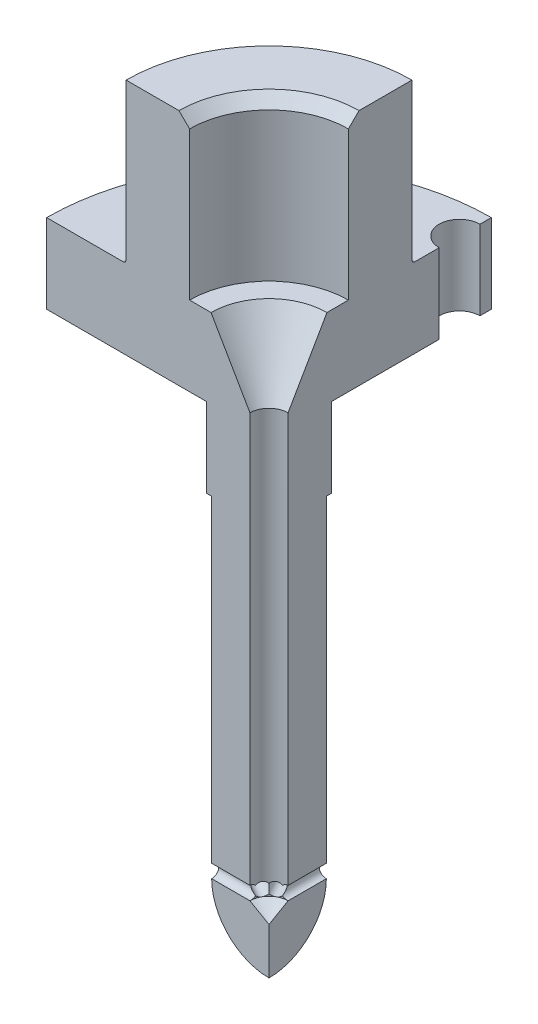
from build123d import *

# Parameters (mm, degrees)
SKETCH1_W               = 3.0607
SKETCH1_H               = 26.48712
SKETCH3_R               = 4.5847
SKETCH3_R_2             = 1.524
BOSS_EXTRUDE1_DEPTH     = 6.35
BOSS_EXTRUDE2_START     = 6.35
SKETCH4_R               = 17.78
SKETCH4_R_2             = 1.524
BOSS_EXTRUDE2_DEPTH     = 6.35
CUT_EXTRUDE2_REACH      = 48.561
SKETCH11_R              = 1.63195
CIRPATTERN2_COUNT       = 6
CHAMFER1_SIZE           = 3.11277
CHAMFER1_SIZE2          = 5.391475792
SKETCH13_R              = 11.43
SKETCH13_R_2            = 6.35
BOSS_EXTRUDE4_DEPTH     = 12.7
FILLET4_R               = 0.254
CHAMFER2_SIZE           = 0.851662
CHAMFER2_SIZE2          = 0.83947
SKETCH15_R              = 4.99999
SKETCH15_R_2            = 3.556
BOSS_EXTRUDE5_DEPTH     = 6.35
CUT_EXTRUDE3_REACH      = 58.272
SKETCH20_R              = 0.5334
CIRPATTERN3_COUNT       = 12
CUT_EXTRUDE4_DEPTH      = 62.816852509
CUT_EXTRUDE4_DEPTH_BACK = 62.816852509


with BuildPart() as part:
    # Sketch1 → Revolve2 (revolve)
    with BuildSketch(Plane.XY, mode=Mode.PRIVATE) as revolve2_sk:
        with Locations((-3.05435, 9.835214136)):
            Rectangle(SKETCH1_W, SKETCH1_H)
    revolve(revolve2_sk.sketch.rotate(Axis((0, 8.215698649, 0), (0, -1, 0)), 270), axis=Axis((0, 8.215698649, 0), (0, -1, 0)))

    # Sketch3 → Boss-Extrude1 (add)
    with BuildSketch(Plane(origin=(0, 23.078774136, 0), x_dir=(-1, 0, 0), z_dir=(0, -1, 0))):
        with Locations(Location((0, 0, 0), (0, 0, 270))):
            Circle(SKETCH3_R)
        with Locations(Location((0, 0, 0), (0, 0, 270))):
            Circle(SKETCH3_R_2, mode=Mode.SUBTRACT)
    extrude(amount=-BOSS_EXTRUDE1_DEPTH)

    # Sketch4 → Boss-Extrude2 (add)
    with BuildSketch(Plane(origin=(0, 29.428774136, 0), x_dir=(1, 0, 0), z_dir=(0, 1, 0)).offset(BOSS_EXTRUDE2_START)):
        with Locations(Location((0, 0, 0), (0, 0, 270))):
            Circle(SKETCH4_R)
        with Locations(Location((0, 0, 0), (0, 0, 270))):
            Circle(SKETCH4_R_2, mode=Mode.SUBTRACT)
    extrude(amount=-BOSS_EXTRUDE2_DEPTH)

    # Sketch11 → Cut-Extrude2 (cut, up to next)
    with BuildSketch(Plane(origin=(0, 35.778774136, 0), x_dir=(1, 0, 0), z_dir=(0, 1, 0)), mode=Mode.PRIVATE) as cut_extrude2_sk1:
        with Locations(Location((0, -15.24, 0), (0, 0, 270))):
            Circle(SKETCH11_R)
    cut_extrude2_tool1 = extrude(cut_extrude2_sk1.sketch, amount=-CUT_EXTRUDE2_REACH, mode=Mode.PRIVATE) & part.part
    cut_extrude2 = cut_extrude2_tool1.solids().sort_by_distance((0, 35.778774, 15.24))[0]
    add(cut_extrude2, mode=Mode.SUBTRACT)

    # CirPattern2: Cut-Extrude2 ×6 about axis
    cirpattern2_axis = Axis((0, 0, 0), (0, 1, 0))
    for i in range(1, CIRPATTERN2_COUNT):
        add(cut_extrude2.rotate(cirpattern2_axis, i * 360 / CIRPATTERN2_COUNT), mode=Mode.SUBTRACT)

    # Chamfer1
    chamfer1_edges = [part.edges().sort_by_distance(p)[0] for p in [
        (0, 35.778774136, -1.524),
    ]]
    chamfer1_side = [part.faces().sort_by_distance(p)[0] for p in [
        (0, 35.778774136, -17.277105657),
    ]]
    chamfer(chamfer1_edges, length=CHAMFER1_SIZE, length2=CHAMFER1_SIZE2, reference=chamfer1_side[0])

    # Sketch13 → Boss-Extrude4 (add)
    with BuildSketch(Plane(origin=(0, 35.778774136, 0), x_dir=(1, 0, 0), z_dir=(0, 1, 0))):
        with Locations(Location((0, 0, 0), (0, 0, 270))):
            Circle(SKETCH13_R)
        with Locations(Location((0, 0, 0), (0, 0, 270))):
            Circle(SKETCH13_R_2, mode=Mode.SUBTRACT)
    extrude(amount=BOSS_EXTRUDE4_DEPTH)

    # Fillet4
    fillet4_edges = [part.edges().sort_by_distance(p)[0] for p in [
        (0, 35.778774136, -11.43),
    ]]
    fillet(fillet4_edges, radius=FILLET4_R)

    # Chamfer2
    chamfer2_edges = [part.edges().sort_by_distance(p)[0] for p in [
        (0, 48.478774136, -6.35),
    ]]
    chamfer2_side = [part.faces().sort_by_distance(p)[0] for p in [
        (0, 48.478774136, -11.10671078),
    ]]
    chamfer(chamfer2_edges, length=CHAMFER2_SIZE, length2=CHAMFER2_SIZE2, reference=chamfer2_side[0])

    # Sketch15 → Boss-Extrude5 (add)
    with BuildSketch(Plane.XZ.offset(-29.428774136)):
        with Locations(Location((0, 0, 0), (0, 0, 90))):
            Circle(SKETCH15_R)
        Circle(SKETCH15_R_2, mode=Mode.SUBTRACT)
    extrude(amount=BOSS_EXTRUDE5_DEPTH)

    # Sketch19 → Revolve4 (revolve)
    with BuildSketch(Plane.XY):
        with BuildLine():
            Line((0, -3.408345864), (-4.5847, -3.408345864))
            ThreePointArc((-4.5847, -3.408345864), (-3.24187246, -6.650218324), (0, -7.993045864))
            Line((0, -7.993045864), (0, -3.408345864))
        make_face()
    revolve(axis=Axis((0, -3.408345864, 0), (0, -1, 0)))

    # Sketch20 → Cut-Extrude3 (cut, up to next)
    with BuildSketch(Plane.ZY.offset(4.5847), mode=Mode.PRIVATE) as cut_extrude3_sk1:
        with Locations(Location((0, -2.874945864, 0), (0, 0, 270.000000003))):
            Circle(SKETCH20_R)
    cut_extrude3_tool1 = extrude(cut_extrude3_sk1.sketch, amount=-CUT_EXTRUDE3_REACH, mode=Mode.PRIVATE) & part.part
    cut_extrude3 = cut_extrude3_tool1.solids().sort_by_distance((-4.5847, -2.874946, 0))[0]
    add(cut_extrude3, mode=Mode.SUBTRACT)

    # CirPattern3: Cut-Extrude3 ×12 about axis
    cirpattern3_axis = Axis((0, -3.408345864, 0), (0, -1, 0))
    for i in range(1, CIRPATTERN3_COUNT):
        add(cut_extrude3.rotate(cirpattern3_axis, i * 360 / CIRPATTERN3_COUNT), mode=Mode.SUBTRACT)

    # Sketch21 → Cut-Revolve4 (revolve, cut)
    with BuildSketch(Plane.XY, mode=Mode.PRIVATE) as cut_revolve4_sk:
        Polygon((0, -3.408345864), (-1.524, -3.408345864), (0, -4.288227675), align=None)
    revolve(cut_revolve4_sk.sketch.rotate(Axis((0, -3.408345864, 0), (0, -1, 0)), 90), axis=Axis((0, -3.408345864, 0), (0, -1, 0)), mode=Mode.SUBTRACT)

    # Sketch22 → Cut-Extrude4 (cut, two sides: drawn at the far end of the back side and taken through both)
    with BuildSketch(Plane(origin=(0, 48.478774136, 0), x_dir=(1, 0, 0), z_dir=(0, 1, 0)).offset(-CUT_EXTRUDE4_DEPTH_BACK)):
        Polygon((0, 0), (0, 22.202499095), (22.67854755, 22.202499095), (22.67854755, -24.667605352), (-30.449360871, -24.667605352), (-30.449360871, 0), align=None)
    extrude(amount=CUT_EXTRUDE4_DEPTH + CUT_EXTRUDE4_DEPTH_BACK, mode=Mode.SUBTRACT)


solid = part.part
